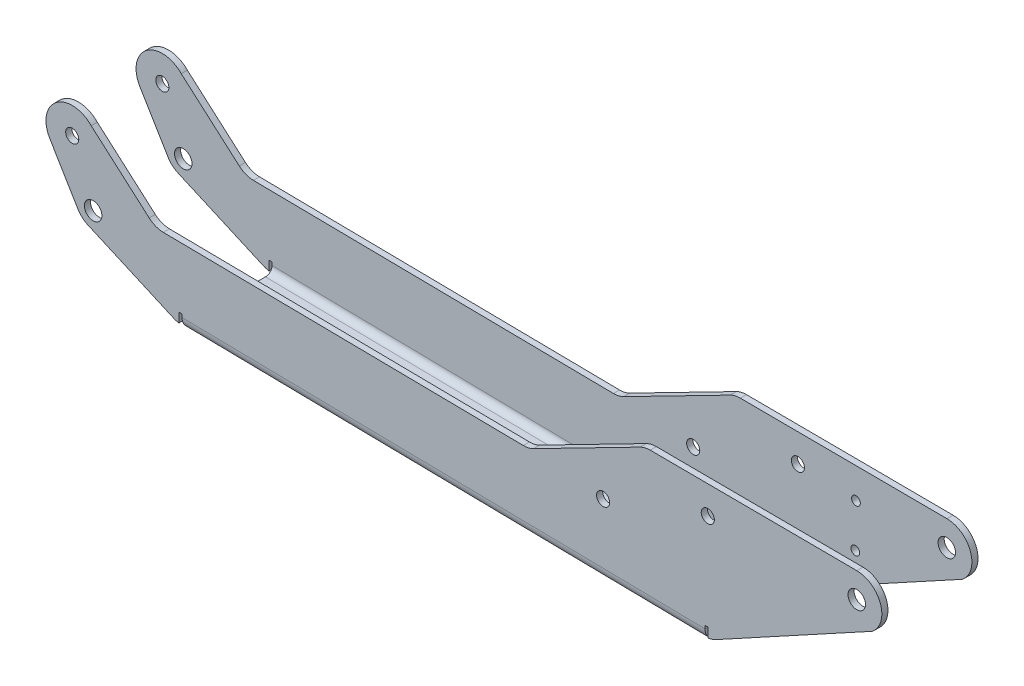
from build123d import *

# Parameters (mm, degrees)
SKETCH2_R                     = 1.5
SKETCH2_R_2                   = 2
BASE_FLANGE1_DEPTH            = 1.4
EDGE_FLANGE1_STRIP_W          = 8.6
EDGE_FLANGE1_STRIP_H          = 1.4
EDGE_FLANGE1_STRIP_CUT_DEPTH  = 119.624404155
EDGE_FLANGE1_RELIEF_W         = 9.3
EDGE_FLANGE1_RELIEF_H         = 0.7
EDGE_FLANGE1_RELIEF_CUT_DEPTH = 1.4
EDGE_FLANGE1_DEPTH            = 119.624404155
SKETCH17_R                    = 1
CUT_EXTRUDE1_DEPTH            = 1.4


# Sheet-metal steps are written as plain solids
with BuildPart() as part:
    # Sketch2 → Base-Flange1 (new body)
    with BuildSketch(Plane.XY):
        with BuildLine():
            Line((231.478213009, 167.923533188), (111.868451864, 169.7951924))
            ThreePointArc((111.868451864, 169.7951924), (110.877145651, 169.910310621), (109.928447229, 170.220006467))
            Line((109.928447229, 170.220006467), (90.352175795, 178.856771959))
            ThreePointArc((90.352175795, 178.856771959), (89.060059005, 179.68413768), (88.079658187, 180.864355486))
            Line((88.079658187, 180.864355486), (81.624256856, 191.654630499))
            ThreePointArc((81.624256856, 191.654630499), (83.137635743, 199.512444421), (91.115351923, 198.886665029))
            Line((91.115351923, 198.886665029), (104.374715918, 187.262186129))
            ThreePointArc((104.374715918, 187.262186129), (105.880179055, 186.353553036), (107.60711557, 186.022307468))
            Line((107.60711557, 186.022307468), (189.939055045, 184.972638911))
            ThreePointArc((189.939055045, 184.972638911), (191.144825453, 185.104402623), (192.283387705, 185.522636952))
            Line((192.283387705, 185.522636952), (216.658747604, 198.015961736))
            ThreePointArc((216.658747604, 198.015961736), (217.779120548, 198.429892832), (218.965699032, 198.5662966))
            Line((218.965699032, 198.5662966), (266.21359493, 198.317204861))
            ThreePointArc((266.21359493, 198.317204861), (271.61517707, 194.425420779), (269.70061588, 188.049095159))
            Line((269.70061588, 188.049095159), (233.952189626, 168.534253774))
            ThreePointArc((233.952189626, 168.534253774), (232.754760905, 168.068640994), (231.478213009, 167.923533188))
        make_face()
        with Locations((86.776445718, 194.736984451)):
            Circle(SKETCH2_R, mode=Mode.SUBTRACT)
        with Locations((91.568382251, 182.289296649)):
            Circle(SKETCH2_R_2, mode=Mode.SUBTRACT)
        with Locations((208.186382216, 183.518819995)):
            Circle(SKETCH2_R, mode=Mode.SUBTRACT)
        with Locations((232.122136742, 192.086173294)):
            Circle(SKETCH2_R, mode=Mode.SUBTRACT)
        with Locations((266.183352442, 192.580788532)):
            Circle(SKETCH2_R_2, mode=Mode.SUBTRACT)
    extrude(amount=-BASE_FLANGE1_DEPTH)

    # Edge-Flange1 strip (across the edge) → Edge-Flange1 strip cut (cut)
    with BuildSketch(Plane(origin=(231.478213009, 167.923533188, -1.4), x_dir=(0.015646131950223352, 0.9998775917856126, -3.4914813388431334e-15), z_dir=(-0.9998775917856126, 0.015646131950223352, 0))):
        with Locations((-2.8, -0.7)):
            Rectangle(EDGE_FLANGE1_STRIP_W, EDGE_FLANGE1_STRIP_H)
    extrude(amount=EDGE_FLANGE1_STRIP_CUT_DEPTH, mode=Mode.SUBTRACT)

    # Edge-Flange1 relief (on the sheet) → Edge-Flange1 relief cut (cut)
    with BuildSketch(Plane(origin=(231.501682207, 169.423349576, -1.4), x_dir=(0.015646131950223352, 0.9998775917856126, -6.982962677686267e-15), z_dir=(0, 0, -1))):
        with Locations((-3.95, 0.35)):
            Rectangle(EDGE_FLANGE1_RELIEF_W, EDGE_FLANGE1_RELIEF_H)
        with Locations((-3.95, -119.974404155)):
            Rectangle(EDGE_FLANGE1_RELIEF_W, EDGE_FLANGE1_RELIEF_H)
    extrude(amount=-EDGE_FLANGE1_RELIEF_CUT_DEPTH, mode=Mode.SUBTRACT)

    # Edge-Flange1 section (across the edge) → Edge-Flange1 (add)
    with BuildSketch(Plane(origin=(231.478213009, 167.923533188, -1.4), x_dir=(0.015646131950223352, 0.9998775917856126, -3.4914813388431334e-15), z_dir=(-0.9998775917856126, 0.015646131950223352, 0))):
        with BuildLine():
            Line((-1.4, 1.5), (-1.4, 9.6))
            Line((-1.4, 9.6), (0, 9.6))
            Line((0, 9.6), (0, 1.5))
            ThreePointArc((0, 1.5), (0.439339828, 0.439339828), (1.5, 0))
            Line((1.5, 0), (1.5, -1.4))
            ThreePointArc((1.5, -1.4), (-0.550609665, -0.550609665), (-1.4, 1.5))
        make_face()
    extrude(amount=EDGE_FLANGE1_DEPTH)

    # Mirror1: part across plane


with BuildPart() as part_1:
    add(part.part)
    add(part.part.mirror(Plane(origin=(231.456308425, 166.52370456, -11), x_dir=(1, 0, 0), z_dir=(0, 0, 1))))

    # Sketch17 → Cut-Extrude1 (cut)
    with BuildSketch(Plane(origin=(0, 0, -22), x_dir=(-1, 0, 0), z_dir=(0, 0, -1))):
        with Locations(Location((-245.401847545, 191.466522217, 0), (0, 0, 90))):
            Circle(SKETCH17_R)
        with Locations(Location((-245.26459516, 181.540767155, 0), (0, 0, 90))):
            Circle(SKETCH17_R)
    extrude(amount=-CUT_EXTRUDE1_DEPTH, mode=Mode.SUBTRACT)


solid = part_1.part
